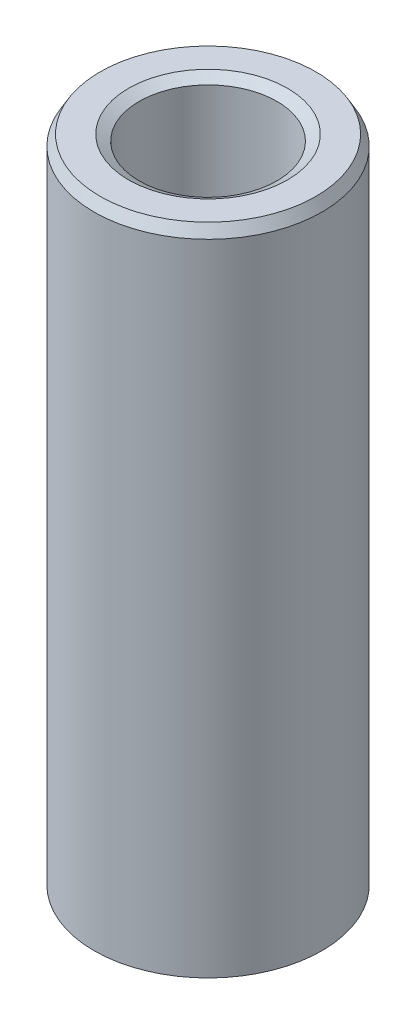
from build123d import *
from OCP.BRepFilletAPI import BRepFilletAPI_MakeChamfer

# Parameters (mm, degrees)
SKETCH1_R           = 15
BOSS_EXTRUDE1_DEPTH = 86.365566853
SKETCH2_R           = 9.066874202
CUT_EXTRUDE1_DEPTH  = 89.932621336
CHAMFER1_SIZE       = 1.387244085
CHAMFER1_SIZE2      = 0.800925746


with BuildPart() as part:
    # Sketch1 → Boss-Extrude1 (new body)
    with BuildSketch(Plane(origin=(0, 0, 0), x_dir=(1, 0, 0), z_dir=(0, 1, 0))):
        Circle(SKETCH1_R)
    extrude(amount=BOSS_EXTRUDE1_DEPTH)

    # Sketch2 → Cut-Extrude1 (cut, through all)
    with BuildSketch(Plane(origin=(0, 0, 0), x_dir=(1, 0, 0), z_dir=(0, 1, 0))):
        Circle(SKETCH2_R)
    extrude(amount=CUT_EXTRUDE1_DEPTH, mode=Mode.SUBTRACT)

    # Chamfer1: one chamfer whose edges measure the first distance from different faces: ONE call of the kernel's chamfer builder (chamfer() names one face for all edges)
    chamfer1_edges_1 = [part.edges().sort_by_distance(p)[0] for p in [
        (-9.066874202, 86.365566853, 0),
    ]]
    chamfer1_side_1 = [part.faces().sort_by_distance(p)[0] for p in [
        (-14.575735931, 86.365566853, 0),
    ]]
    chamfer1_edges_2 = [part.edges().sort_by_distance(p)[0] for p in [
        (-9.066874202, 0, 0),
    ]]
    chamfer1_side_2 = [part.faces().sort_by_distance(p)[0] for p in [
        (-9.066874202, 43.182783426, 0),
    ]]
    chamfer1_edges_3 = [part.edges().sort_by_distance(p)[0] for p in [
        (-15, 0, 0),
    ]]
    chamfer1_side_3 = [part.faces().sort_by_distance(p)[0] for p in [
        (-14.575735931, 0, 0),
    ]]
    chamfer1_edges_4 = [part.edges().sort_by_distance(p)[0] for p in [
        (-15, 86.365566853, 0),
    ]]
    chamfer1_side_4 = [part.faces().sort_by_distance(p)[0] for p in [
        (-15, 43.182783426, 0),
    ]]
    chamfer1 = BRepFilletAPI_MakeChamfer(part.part.solid().wrapped)
    for e in chamfer1_edges_1:
        chamfer1.Add(CHAMFER1_SIZE, CHAMFER1_SIZE2, e.wrapped, chamfer1_side_1[0].wrapped)  # the first distance lies on this face
    for e in chamfer1_edges_2:
        chamfer1.Add(CHAMFER1_SIZE, CHAMFER1_SIZE2, e.wrapped, chamfer1_side_2[0].wrapped)  # the first distance lies on this face
    for e in chamfer1_edges_3:
        chamfer1.Add(CHAMFER1_SIZE, CHAMFER1_SIZE2, e.wrapped, chamfer1_side_3[0].wrapped)  # the first distance lies on this face
    for e in chamfer1_edges_4:
        chamfer1.Add(CHAMFER1_SIZE, CHAMFER1_SIZE2, e.wrapped, chamfer1_side_4[0].wrapped)  # the first distance lies on this face
    add(Compound.cast(chamfer1.Shape()), mode=Mode.REPLACE)


solid = part.part
